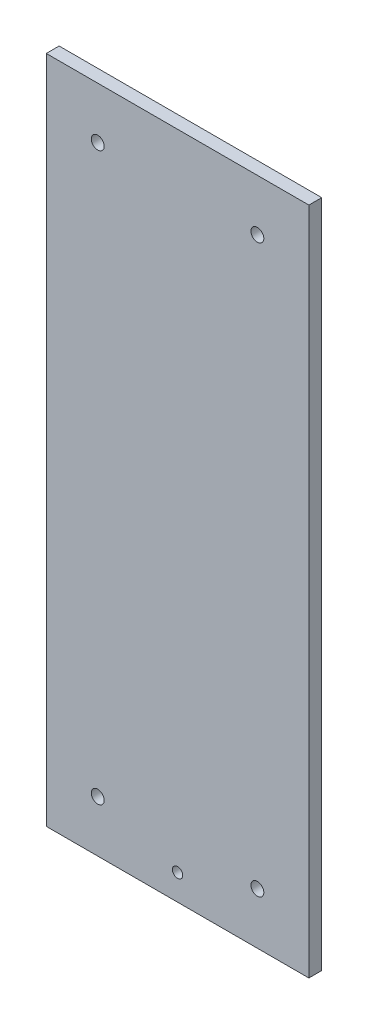
from build123d import *

# Parameters (mm, degrees)
SKETCH1_W            = 129.54
SKETCH1_H            = 330.2
MAIN_PLATE_DEPTH     = 6.35
SKETCH2_R            = 3.175
BOLT_HOLES_DEPTH     = 6.35
LPATTERN1_COUNT      = 2
LPATTERN1_PITCH      = 78.74
LPATTERN1_COUNT_DIR2 = 2
LPATTERN1_PITCH_DIR2 = 279.4
SKETCH3_R            = 2.54
WIRE_HOLE_DEPTH      = 6.35


with BuildPart() as part:
    # Sketch1 → Main Plate (new body)
    with BuildSketch(Plane.XY):
        with Locations((64.77, 165.1)):
            Rectangle(SKETCH1_W, SKETCH1_H)
    extrude(amount=MAIN_PLATE_DEPTH)

    # Sketch2 → Bolt Holes (cut)
    with BuildSketch(Plane.XY.offset(6.35)):
        with Locations((25.4, 304.8)):
            Circle(SKETCH2_R)
    bolt_holes = extrude(amount=-BOLT_HOLES_DEPTH, mode=Mode.SUBTRACT)

    # LPattern1: Bolt Holes 2 × 2
    with Locations(*[(i * LPATTERN1_PITCH, -j * LPATTERN1_PITCH_DIR2, 0) for i in range(LPATTERN1_COUNT) for j in range(LPATTERN1_COUNT_DIR2) if (i, j) != (0, 0)]):
        add(bolt_holes, mode=Mode.SUBTRACT)

    # Sketch3 → Wire Hole (cut)
    with BuildSketch(Plane.XY.offset(6.35)):
        with Locations((64.77, 12.7)):
            Circle(SKETCH3_R)
    extrude(amount=-WIRE_HOLE_DEPTH, mode=Mode.SUBTRACT)


solid = part.part
